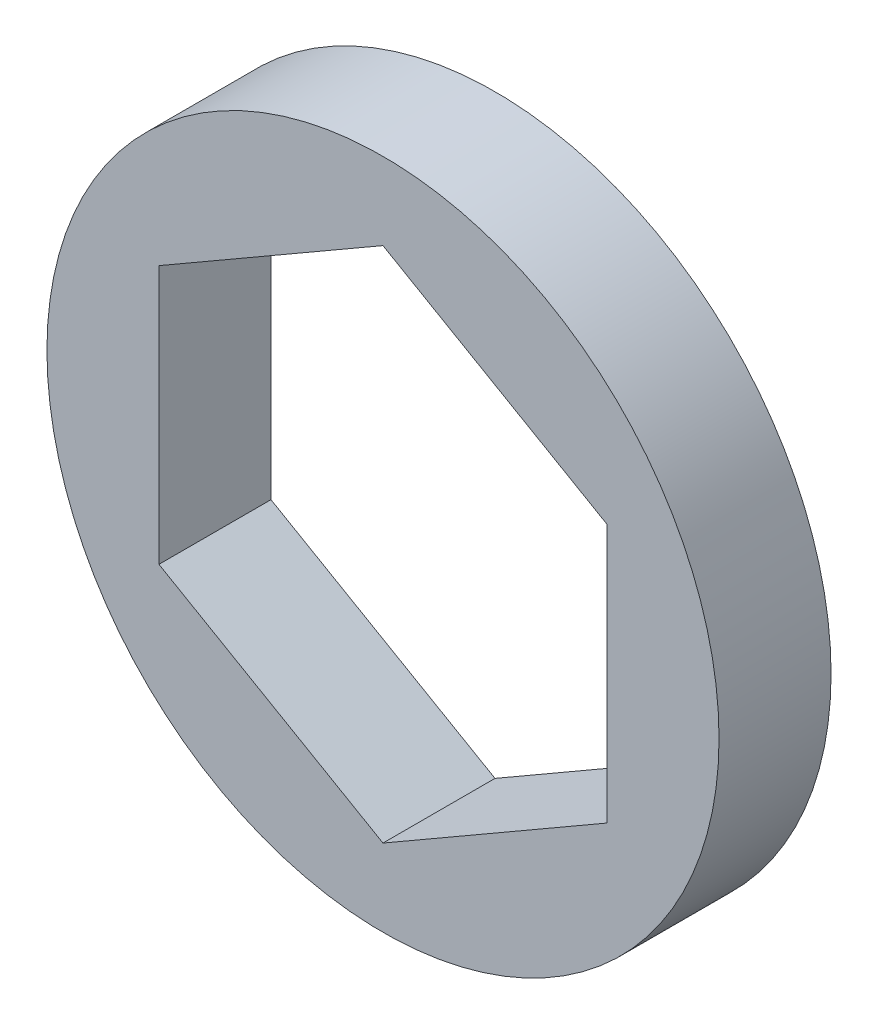
from build123d import *

# Parameters (mm, degrees)
SKETCH1_R           = 19.05
BOSS_EXTRUDE1_DEPTH = 3.175


with BuildPart() as part:
    # Sketch1 → Boss-Extrude1 (new, symmetric)
    with BuildSketch(Plane.XY):
        Circle(SKETCH1_R)
        Polygon((0, 14.664696837), (-12.7, 7.332348419), (-12.7, -7.332348419), (0, -14.664696837), (12.7, -7.332348419), (12.7, 7.332348419), align=None, mode=Mode.SUBTRACT)
    extrude(amount=BOSS_EXTRUDE1_DEPTH, both=True)


solid = part.part
